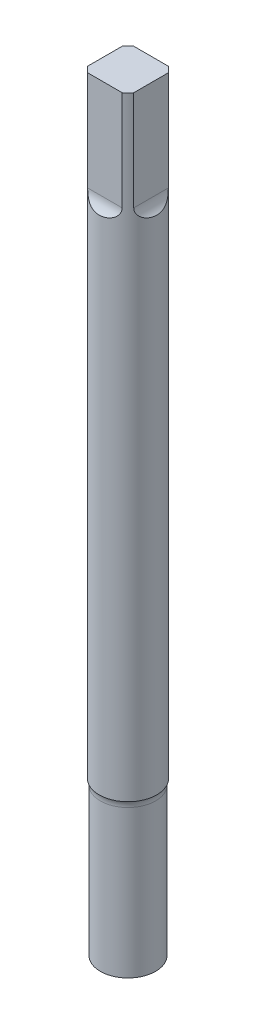
from build123d import *

# Parameters (mm, degrees)
SKETCH1_R           = 4.7625
BOSS_EXTRUDE1_DEPTH = 101.6
SKETCH2_W           = 11.315378495
SKETCH2_H           = 2.135355531
CUT_EXTRUDE1_DEPTH  = 19.05
SKETCH3_W           = 2.441021898
SKETCH3_H           = 8.016208274
CUT_EXTRUDE2_DEPTH  = 19.05
FILLET1_R           = 2.54
SKETCH4_R           = 4.572
BOSS_EXTRUDE2_DEPTH = 25.4
FILLET2_R           = 2.54


with BuildPart() as part:
    # Sketch1 → Boss-Extrude1 (new body)
    with BuildSketch(Plane(origin=(0, 0, 0), x_dir=(1, 0, 0), z_dir=(0, 1, 0))):
        with Locations(Location((0, 0, 0), (0, 0, 270))):
            Circle(SKETCH1_R)
    extrude(amount=-BOSS_EXTRUDE1_DEPTH)

    # Sketch2 → Cut-Extrude1 (cut)
    with BuildSketch(Plane(origin=(0, 0, 0), x_dir=(1, 0, 0), z_dir=(0, 1, 0))):
        with Locations((0.38675801, 4.877677766)):
            Rectangle(SKETCH2_W, SKETCH2_H)
        with Locations((-0.38675801, -4.877677766)):
            Rectangle(SKETCH2_W, SKETCH2_H)
    extrude(amount=-CUT_EXTRUDE1_DEPTH, mode=Mode.SUBTRACT)

    # Sketch3 → Cut-Extrude2 (cut)
    with BuildSketch(Plane(origin=(0, 0, 0), x_dir=(1, 0, 0), z_dir=(0, 1, 0))):
        with Locations((5.030510949, -0.198104137)):
            Rectangle(SKETCH3_W, SKETCH3_H)
        with Locations((-5.030510949, 0.198104137)):
            Rectangle(SKETCH3_W, SKETCH3_H)
    extrude(amount=-CUT_EXTRUDE2_DEPTH, mode=Mode.SUBTRACT)

    # Fillet1
    # the kernel refuses this fillet: 2.54 mm, written as the material it adds along each edge
    with BuildSketch(Plane(origin=(9.2075, -19.05, -3.81), x_dir=(0, 1, 0), z_dir=(-1, 0, 0))) as fillet1_piece_1_section:
        with BuildLine():
            CenterArc((FILLET1_R, FILLET1_R), FILLET1_R, 180, 90)
            Line((0, FILLET1_R), (0, 0))
            Line((0, 0), (FILLET1_R, 0))
        make_face()
    fillet1_piece_1 = extrude(amount=18.415, mode=Mode.PRIVATE)
    fillet1_piece_1 = fillet1_piece_1 & Plane(origin=(0, -18.276812149, 0), x_dir=(0, 0, 1), z_dir=(0, 1, 0)) * Cylinder(4.7625, 47, mode=Mode.PRIVATE)
    add(fillet1_piece_1)
    with BuildSketch(Plane(origin=(3.81, -19.05, 9.2075), x_dir=(0, 1, 0), z_dir=(0, 0, -1))) as fillet1_piece_2_section:
        with BuildLine():
            CenterArc((FILLET1_R, FILLET1_R), FILLET1_R, 180, 90)
            Line((0, FILLET1_R), (0, 0))
            Line((0, 0), (FILLET1_R, 0))
        make_face()
    fillet1_piece_2 = extrude(amount=18.415, mode=Mode.PRIVATE)
    fillet1_piece_2 = fillet1_piece_2 & Plane(origin=(0, -18.276812149, 0), x_dir=(0, 0, 1), z_dir=(0, 1, 0)) * Cylinder(4.7625, 47, mode=Mode.PRIVATE)
    add(fillet1_piece_2)
    with BuildSketch(Plane(origin=(-3.81, -19.05, -9.2075), x_dir=(0, 1, 0), z_dir=(0, 0, 1))) as fillet1_piece_3_section:
        with BuildLine():
            CenterArc((FILLET1_R, FILLET1_R), FILLET1_R, 180, 90)
            Line((0, FILLET1_R), (0, 0))
            Line((0, 0), (FILLET1_R, 0))
        make_face()
    fillet1_piece_3 = extrude(amount=18.415, mode=Mode.PRIVATE)
    fillet1_piece_3 = fillet1_piece_3 & Plane(origin=(0, -18.276812149, 0), x_dir=(0, 0, 1), z_dir=(0, 1, 0)) * Cylinder(4.7625, 47, mode=Mode.PRIVATE)
    add(fillet1_piece_3)
    with BuildSketch(Plane(origin=(9.2075, -19.05, 3.81), x_dir=(0, 0, 1), z_dir=(-1, 0, 0))) as fillet1_piece_4_section:
        with BuildLine():
            CenterArc((FILLET1_R, FILLET1_R), FILLET1_R, 180, 90)
            Line((0, FILLET1_R), (0, 0))
            Line((0, 0), (FILLET1_R, 0))
        make_face()
    fillet1_piece_4 = extrude(amount=18.415, mode=Mode.PRIVATE)
    fillet1_piece_4 = fillet1_piece_4 & Plane(origin=(0, -18.276814904, 0), x_dir=(0, 0, 1), z_dir=(0, 1, 0)) * Cylinder(4.7625, 47, mode=Mode.PRIVATE)
    add(fillet1_piece_4)

    # Sketch4 → Boss-Extrude2 (add)
    with BuildSketch(Plane.XZ.offset(101.6)):
        with Locations(Location((0, 0, 0), (0, 0, 270))):
            Circle(SKETCH4_R)
    extrude(amount=BOSS_EXTRUDE2_DEPTH)

    # Fillet2
    # the kernel refuses this fillet: 2.54 mm, written as the material it adds along each edge
    with BuildSketch(Plane(origin=(0, -101.6, 0), x_dir=(0, 0, -1), z_dir=(-1, 0, 0))) as fillet2_piece_1:
        with BuildLine():
            CenterArc((7.112, 0.965116444), FILLET2_R, 180, 22.331645009)
            Line((4.572, 0.965116444), (4.5212, 0.965116444))
            Line((4.5212, 0.965116444), (4.5212, 0))
            Line((4.5212, 0), (4.572, -0.0508))
            ThreePointArc((4.572, -0.0508), (4.66725, -0.0508), (4.71551, -0.019302329))
            Line((4.71551, -0.019302329), (4.7625, 0))
        make_face()
    revolve(axis=Axis((0, -101.6, 0), (0, -1, 0)))


solid = part.part
